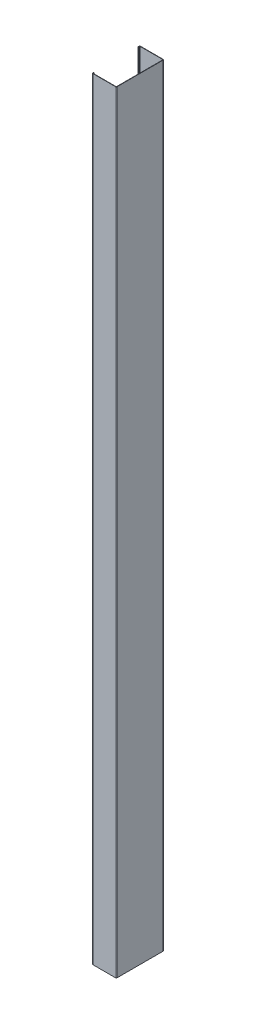
from build123d import *

# Parameters (mm, degrees)
SM_BASE_FLANGE_1_DEPTH = 1600


# Sheet-metal steps are written as plain solids
with BuildPart() as part:
    # Sketch 1 → Базовая кромка1 (new body)
    with BuildSketch(Plane(origin=(0, 0, 0), x_dir=(1, 0, 0), z_dir=(0, 1, 0))):
        with BuildLine():
            Line((-50, 46.25), (-50, 47.75))
            ThreePointArc((-50, 47.75), (-49.560660172, 48.810660172), (-48.5, 49.25))
            Line((-48.5, 49.25), (-1.5, 49.25))
            ThreePointArc((-1.5, 49.25), (-0.439339828, 48.810660172), (0, 47.75))
            Line((0, 47.75), (0, -47.75))
            ThreePointArc((0, -47.75), (-0.439339828, -48.810660172), (-1.5, -49.25))
            Line((-1.5, -49.25), (-48.5, -49.25))
            ThreePointArc((-48.5, -49.25), (-49.560660172, -48.810660172), (-50, -47.75))
            Line((-50, -47.75), (-50, -46.25))
            Line((-50, -46.25), (-49.25, -46.25))
            Line((-49.25, -46.25), (-49.25, -47.75))
            ThreePointArc((-49.25, -47.75), (-49.030330086, -48.280330086), (-48.5, -48.5))
            Line((-48.5, -48.5), (-1.5, -48.5))
            ThreePointArc((-1.5, -48.5), (-0.969669914, -48.280330086), (-0.75, -47.75))
            Line((-0.75, -47.75), (-0.75, 47.75))
            ThreePointArc((-0.75, 47.75), (-0.969669914, 48.280330086), (-1.5, 48.5))
            Line((-1.5, 48.5), (-48.5, 48.5))
            ThreePointArc((-48.5, 48.5), (-49.030330086, 48.280330086), (-49.25, 47.75))
            Line((-49.25, 47.75), (-49.25, 46.25))
            Line((-49.25, 46.25), (-50, 46.25))
        make_face()
    extrude(amount=SM_BASE_FLANGE_1_DEPTH)


solid = part.part
